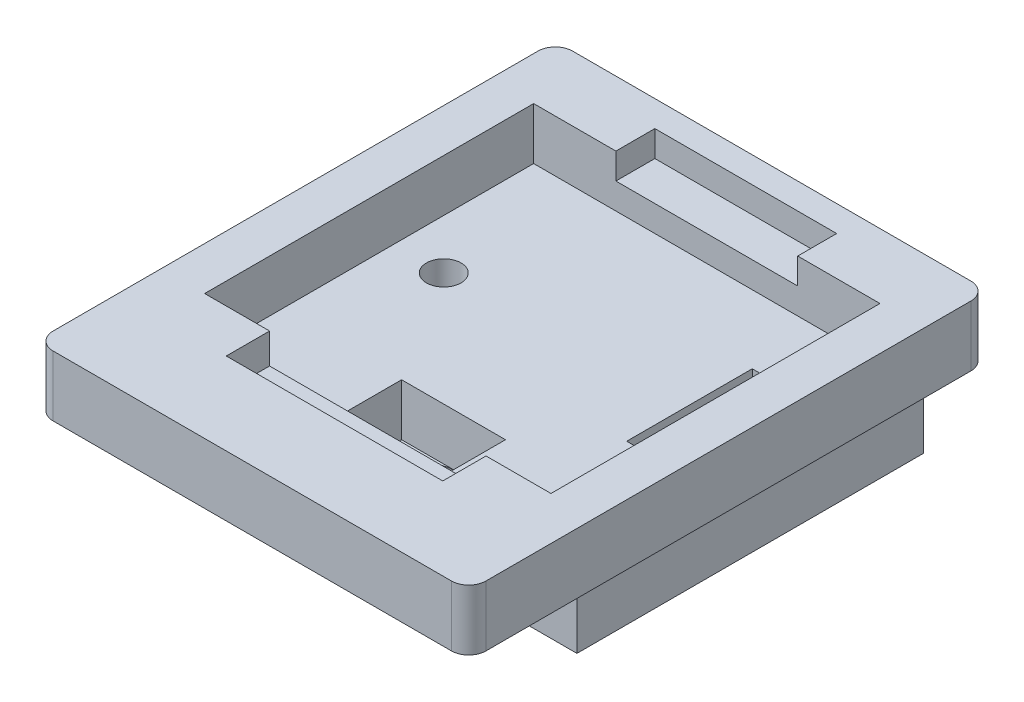
from build123d import *

# Parameters (mm, degrees)
SKETCH1_W           = 50
SKETCH1_H           = 60
BOSS_EXTRUDE1_DEPTH = 15
FILLET1_R           = 2
SKETCH2_W           = 40
SKETCH2_H           = 38
CUT_EXTRUDE1_DEPTH  = 6
SKETCH3_W           = 4
SKETCH3_H           = 14.5
CUT_EXTRUDE2_DEPTH  = 10
SKETCH4_R           = 2
CUT_EXTRUDE3_DEPTH  = 10
SKETCH5_W           = 12
SKETCH5_H           = 6.5
CUT_EXTRUDE4_DEPTH  = 6
SKETCH6_R           = 3.2
CUT_EXTRUDE5_DEPTH  = 8
SKETCH7_W           = 25
SKETCH7_H           = 10
CUT_EXTRUDE6_DEPTH  = 3.5
SKETCH8_W           = 51.392130936
SKETCH8_H           = 62.084358578
SKETCH8_W_2         = 45
SKETCH8_H_2         = 40
CUT_EXTRUDE7_DEPTH  = 8
SKETCH9_W           = 21
SKETCH9_H           = 9
CUT_EXTRUDE8_DEPTH  = 3
FILLET2_R           = 2


with BuildPart() as part:
    # Sketch1 → Boss-Extrude1 (new body)
    with BuildSketch(Plane(origin=(0, 0, 0), x_dir=(1, 0, 0), z_dir=(0, 1, 0))):
        Rectangle(SKETCH1_W, SKETCH1_H)
    extrude(amount=BOSS_EXTRUDE1_DEPTH)

    # Fillet1
    fillet1_edges = [part.edges().sort_by_distance(p)[0] for p in [
        (-25, 7.5, 30),
        (25, 7.5, 30),
        (25, 7.5, -30),
        (-25, 7.5, -30),
    ]]
    fillet(fillet1_edges, radius=FILLET1_R)

    # Sketch2 → Cut-Extrude1 (cut)
    with BuildSketch(Plane(origin=(0, 15, 0), x_dir=(1, 0, 0), z_dir=(0, 1, 0))):
        with Locations((0, 3.5)):
            Rectangle(SKETCH2_W, SKETCH2_H)
    extrude(amount=-CUT_EXTRUDE1_DEPTH, mode=Mode.SUBTRACT)

    # Sketch3 → Cut-Extrude2 (cut)
    with BuildSketch(Plane(origin=(0, 9, 0), x_dir=(1, 0, 0), z_dir=(0, 1, 0))):
        with Locations((15.15, 7.35)):
            Rectangle(SKETCH3_W, SKETCH3_H)
    extrude(amount=-CUT_EXTRUDE2_DEPTH, mode=Mode.SUBTRACT)

    # Sketch4 → Cut-Extrude3 (cut)
    with BuildSketch(Plane.XZ):
        with Locations((-14.251980034, -6.369003384)):
            Circle(SKETCH4_R)
    extrude(amount=-CUT_EXTRUDE3_DEPTH, mode=Mode.SUBTRACT)

    # Sketch5 → Cut-Extrude4 (cut)
    with BuildSketch(Plane(origin=(0, 9, 0), x_dir=(1, 0, 0), z_dir=(0, 1, 0))):
        with Locations((0, -10)):
            Rectangle(SKETCH5_W, SKETCH5_H)
    extrude(amount=-CUT_EXTRUDE4_DEPTH, mode=Mode.SUBTRACT)

    # Sketch6 → Cut-Extrude5 (cut)
    with BuildSketch(Plane.XZ):
        with Locations((0, 10)):
            Circle(SKETCH6_R)
    extrude(amount=-CUT_EXTRUDE5_DEPTH, mode=Mode.SUBTRACT)

    # Sketch7 → Cut-Extrude6 (cut)
    with BuildSketch(Plane(origin=(0, 15, 0), x_dir=(1, 0, 0), z_dir=(0, 1, 0))):
        with Locations((0, -15.5)):
            Rectangle(SKETCH7_W, SKETCH7_H)
    extrude(amount=-CUT_EXTRUDE6_DEPTH, mode=Mode.SUBTRACT)

    # Sketch8 → Cut-Extrude7 (cut)
    with BuildSketch(Plane(origin=(0, 0, 0), x_dir=(-1, 0, 0), z_dir=(0, -1, 0))):
        Rectangle(SKETCH8_W, SKETCH8_H)
        with Locations((0, 5)):
            Rectangle(SKETCH8_W_2, SKETCH8_H_2, mode=Mode.SUBTRACT)
    extrude(amount=-CUT_EXTRUDE7_DEPTH, mode=Mode.SUBTRACT)

    # Sketch9 → Cut-Extrude8 (cut)
    with BuildSketch(Plane(origin=(0, 15, 0), x_dir=(1, 0, 0), z_dir=(0, 1, 0))):
        with Locations((0, 22.5)):
            Rectangle(SKETCH9_W, SKETCH9_H)
    extrude(amount=-CUT_EXTRUDE8_DEPTH, mode=Mode.SUBTRACT)

    # Fillet2
    fillet2_edges = [part.edges().sort_by_distance(p)[0] for p in [
        (-22.5, 8, -5),
        (0, 8, -25),
        (22.5, 8, -5),
        (0, 8, 15),
    ]]
    fillet(fillet2_edges, radius=FILLET2_R)


solid = part.part
